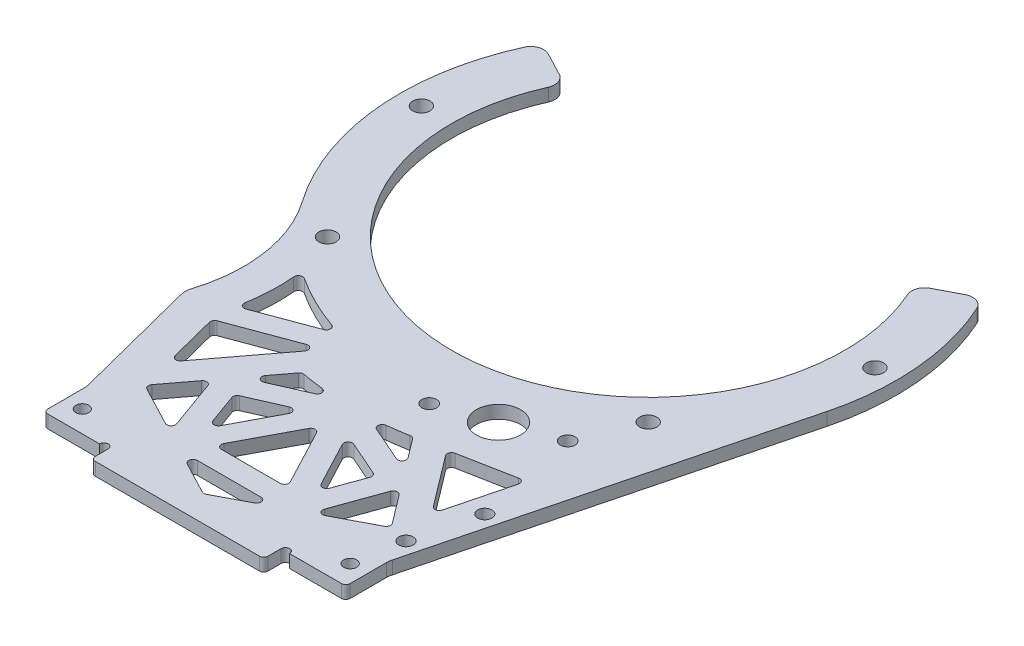
from build123d import *

# Parameters (mm, degrees)
SKETCH_1_R          = 1.7
SKETCH_1_R_2        = 1.5
SKETCH_1_R_3        = 2
SKETCH_1_R_4        = 5.1
SKETCH_1_R_5        = 1.65
EXTRUDE_1_DEPTH     = 3
SKETCH_3_R          = 1
CUT_EXTRUDE_3_DEPTH = 124.273070863
CUT_EXTRUDE_4_DEPTH = 124.273070863
EXTRUDE_START       = -3
EXTRUDE_1_2_DEPTH   = 3
EXTRUDE_2_DEPTH     = 3
FILLET_4_R          = 1
FILLET_6_R          = 5
FILLET_7_R          = 3


# Read off the part's stored shape, not the designer's step: 拉伸-薄壁1
with BuildPart() as part:
    # 草图1 → Extrude 1 (new body)
    with BuildSketch(Plane(origin=(0, 0, 0), x_dir=(1, 0, 0), z_dir=(0, 1, 0))):
        with BuildLine():
            Line((-51.003122908, 26.550545261), (-40.35899291, 21.009561902))
            ThreePointArc((-40.35899291, 21.009561902), (0, -45.5), (40.35899291, 21.009561902))
            Line((40.35899291, 21.009561902), (51.003122908, 26.550545261))
            ThreePointArc((51.003122908, 26.550545261), (57.123657521, 6.567933576), (55.697982668, -14.282322175))
            Line((55.697982668, -14.282322175), (35, -95))
            Line((35, -95), (35, -105))
            Line((35, -105), (20, -105))
            Line((20, -105), (20, -109))
            Line((20, -109), (-20, -109))
            Line((-20, -109), (-20, -105))
            Line((-20, -105), (-35, -105))
            Line((-35, -105), (-35, -95))
            Line((-35, -95), (-55.697982668, -14.282322175))
            ThreePointArc((-55.697982668, -14.282322175), (-57.123657521, 6.567933576), (-51.003122908, 26.550545261))
        make_face()
        with Locations(Location((8.091010553, -58.777423797, 0), (0, 0, 270))):
            Circle(SKETCH_1_R, mode=Mode.SUBTRACT)
        with Locations(Location((31.583326073, -50.226920214, 0), (0, 0, 270))):
            Circle(SKETCH_1_R, mode=Mode.SUBTRACT)
        with Locations(Location((-31, -100, 0), (0, 0, 270))):
            Circle(SKETCH_1_R_2, mode=Mode.SUBTRACT)
        with Locations(Location((31, -100, 0), (0, 0, 90))):
            Circle(SKETCH_1_R_2, mode=Mode.SUBTRACT)
        with Locations(Location((-37.123106012, -37.123106012, 0), (0, 0, 270))):
            Circle(SKETCH_1_R_3, mode=Mode.SUBTRACT)
        with Locations(Location((-52.5, 0, 0), (0, 0, 270))):
            Circle(SKETCH_1_R_3, mode=Mode.SUBTRACT)
        with Locations(Location((52.5, 0, 0), (0, 0, 270))):
            Circle(SKETCH_1_R_3, mode=Mode.SUBTRACT)
        with Locations(Location((37.123106012, -37.123106012, 0), (0, 0, 270))):
            Circle(SKETCH_1_R_3, mode=Mode.SUBTRACT)
        with Locations(Location((19.837168313, -54.502172006, 0), (0, 0, 270))):
            Circle(SKETCH_1_R_4, mode=Mode.SUBTRACT)
        with Locations(Location((32.925309654, -89, 0), (0, 0, 270))):
            Circle(SKETCH_1_R_5, mode=Mode.SUBTRACT)
        with Locations(Location((36.65113283, -74.470091478, 0), (0, 0, 270))):
            Circle(SKETCH_1_R_5, mode=Mode.SUBTRACT)
    extrude(amount=EXTRUDE_1_DEPTH)

    # 草图3 → 切除-拉伸3 (cut, through all)
    with BuildSketch(Plane(origin=(0, 3, 0), x_dir=(1, 0, 0), z_dir=(0, 1, 0))):
        with Locations((-21, -105)):
            Circle(SKETCH_3_R)
        with Locations((21, -105)):
            Circle(SKETCH_3_R)
    extrude(amount=-CUT_EXTRUDE_3_DEPTH, mode=Mode.SUBTRACT)

    # 草图4 → 切除-拉伸4 (cut, through all)
    with BuildSketch(Plane(origin=(0, 3, 0), x_dir=(1, 0, 0), z_dir=(0, 1, 0))):
        with BuildLine():
            Line((-30.440624747, -80.572934593), (-12.021970306, -56.229193752))
            ThreePointArc((-12.021970306, -56.229193752), (-23.121395009, -52.646472748), (-33.269507662, -46.897653033))
            ThreePointArc((-33.269507662, -46.897653033), (-32.970979927, -55.81081258), (-34.539030241, -64.590035219))
            Line((-34.539030241, -64.590035219), (-30.440624747, -80.572934593))
        make_face()
        Polygon((19.433888905, -66.025448201), (34.930515062, -63.063328668), (30.440624747, -80.572934593), align=None)
        with BuildLine():
            Line((28.536143905, -88), (0, -103))
            Line((0, -103), (-28.536143905, -88))
            Line((-28.536143905, -88), (-12.86067095, -67.281893127))
            ThreePointArc((-12.86067095, -67.281893127), (0, -68.5), (12.86067095, -67.281893127))
            Line((12.86067095, -67.281893127), (28.536143905, -88))
        make_face()
        with BuildLine():
            Line((-42.861253018, -64.342805115), (-55.697982668, -14.282322175))
            ThreePointArc((-55.697982668, -14.282322175), (-52.242961211, -24.01922155), (-47.101242547, -32.98064509))
            ThreePointArc((-47.101242547, -32.98064509), (-41.173018347, -48.146873673), (-42.861253018, -64.342805115))
        make_face()
    extrude(amount=-CUT_EXTRUDE_4_DEPTH, mode=Mode.SUBTRACT)

    # Extrude 1 2 outline → Extrude 1 2 (add)
    with BuildSketch(Plane(origin=(0, 3, 0), x_dir=(1, 0, 0), z_dir=(0, 1, 0)).offset(EXTRUDE_START)):
        with BuildLine():
            Line((21.778618406, -79.068649994), (18.835174857, -75.178331775))
            Line((18.835174857, -75.178331775), (3.50933235, -68.410047409))
            ThreePointArc((3.50933235, -68.410047409), (0, -68.5), (-3.50933235, -68.410047409))
            Line((-3.50933235, -68.410047409), (-18.835174857, -75.178331775))
            Line((-18.835174857, -75.178331775), (-21.778618406, -79.068649994))
            Line((-21.778618406, -79.068649994), (-16.234523365, -94.466336472))
            Line((-16.234523365, -94.466336472), (-11.414457562, -97))
            Line((-11.414457562, -97), (11.414457562, -97))
            Line((11.414457562, -97), (16.234523365, -94.466336472))
            Line((16.234523365, -94.466336472), (21.778618406, -79.068649994))
        make_face()
        Polygon((-12.743110853, -89.403790429), (-16.300181473, -79.524692438), (-4.850437176, -74.468192262), align=None, mode=Mode.SUBTRACT)
        Polygon((0, -75.991095057), (8.459859541, -92), (-8.459859541, -92), align=None, mode=Mode.SUBTRACT)
        Polygon((4.850437176, -74.468192262), (16.300181473, -79.524692438), (12.743110853, -89.403790429), align=None, mode=Mode.SUBTRACT)
    extrude(amount=EXTRUDE_1_2_DEPTH)

    # 草图5<3> → 拉伸-薄壁2 (add)
    with BuildSketch(Plane(origin=(0, 3, 0), x_dir=(1, 0, 0), z_dir=(0, 1, 0))):
        Polygon((-35.554014882, -67.633687886), (-11.151745265, -58.572846537), (-12.892195346, -53.885540966), (-37.294464963, -62.946382315), align=None)
    extrude(amount=-EXTRUDE_2_DEPTH)

    # 圆角4
    fillet_4_edges = [part.edges().sort_by_distance(p)[0] for p in [
        (30.440624747, 1.5, 80.572934593),
        (19.433888905, 1.5, 66.025448201),
        (34.930515062, 1.5, 63.063328668),
        (-12.86067095, 1.5, 67.281893127),
        (12.86067095, 1.5, 67.281893127),
        (28.536143905, 1.5, 88),
        (0, 1.5, 103),
        (-28.536143905, 1.5, 88),
        (-30.440624747, 1.5, 80.572934593),
        (-33.269507662, 1.5, 46.897653033),
        (-21.778618406, 1.5, 79.068649994),
        (-18.835174857, 1.5, 75.178331775),
        (-11.414457562, 1.5, 97),
        (16.234523365, 1.5, 94.466336472),
        (18.835174857, 1.5, 75.178331775),
        (3.50933235, 1.5, 68.410047409),
        (21.778618406, 1.5, 79.068649994),
        (11.414457562, 1.5, 97),
        (-3.50933235, 1.5, 68.410047409),
        (-16.234523365, 1.5, 94.466336472),
        (-16.300181473, 1.5, 79.524692438),
        (4.850437176, 1.5, 74.468192262),
        (16.300181473, 1.5, 79.524692438),
        (12.743110853, 1.5, 89.403790429),
        (-4.850437176, 1.5, 74.468192262),
        (-12.743110853, 1.5, 89.403790429),
        (8.459859541, 1.5, 92),
        (-8.459859541, 1.5, 92),
        (0, 1.5, 75.991095057),
        (35, 1.5, 105),
        (20, 1.5, 109),
        (-20, 1.5, 109),
        (-35, 1.5, 105),
        (-14.827987759, 1.5, 59.937877353),
        (-16.285565355, 1.5, 55.145537998),
        (-33.79999967, 1.5, 61.648847449),
        (-33.914652527, 1.5, 67.024973924),
    ]]
    fillet(fillet_4_edges, radius=FILLET_4_R)

    # 圆角6
    fillet_6_edges = [part.edges().sort_by_distance(p)[0] for p in [
        (-42.861253018, 1.5, 64.342805115),
        (-35, 1.5, 95),
        (35, 1.5, 95),
    ]]
    fillet(fillet_6_edges, radius=FILLET_6_R)

    # 圆角7
    fillet_7_edges = [part.edges().sort_by_distance(p)[0] for p in [
        (-51.003122908, 1.5, -26.550545261),
        (-40.35899291, 1.5, -21.009561902),
        (40.35899291, 1.5, -21.009561902),
        (51.003122908, 1.5, -26.550545261),
    ]]
    fillet(fillet_7_edges, radius=FILLET_7_R)


solid = part.part
